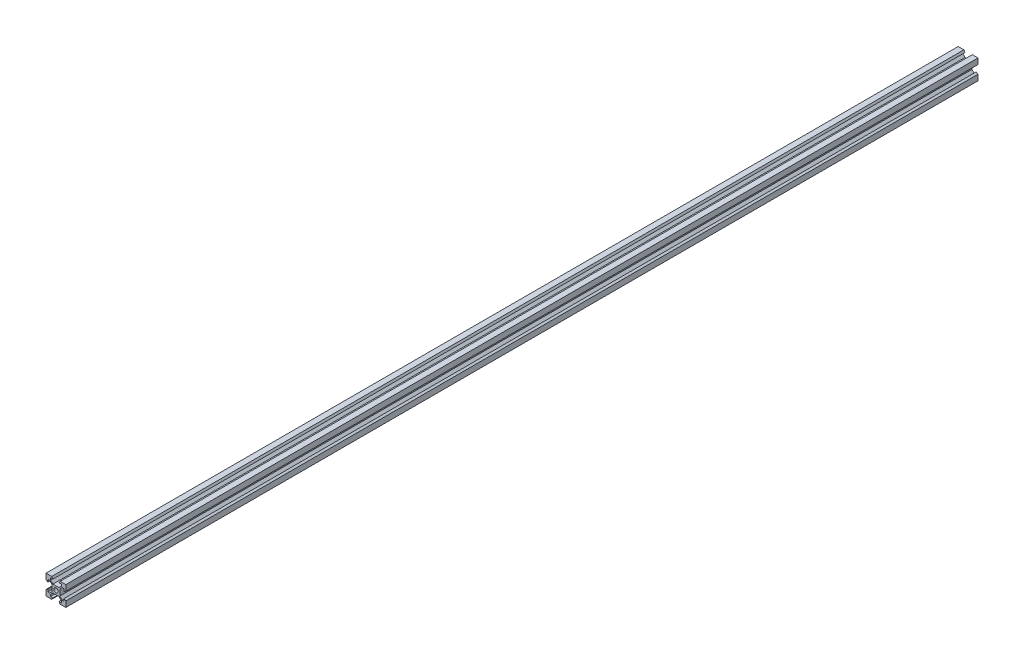
from build123d import *

# Parameters (mm, degrees)
SKETCH1_R           = 2.1
BOSS_EXTRUDE1_DEPTH = 920


with BuildPart() as part:
    # Sketch1 → Boss-Extrude1 (new body)
    with BuildSketch(Plane.XY):
        Polygon((-10, 10), (-4.25, 10), (-3.065, 8.2), (-5.5, 8.2), (-5.5, 6.348528137), (-3.051471863, 3.9), (0, 3.9), (3.051471863, 3.9), (5.5, 6.348528137), (5.5, 8.2), (3.065, 8.2), (4.25, 10), (10, 10), (10, 4.25), (8.2, 3.065), (8.2, 5.5), (6.348528137, 5.5), (3.9, 3.051471863), (3.9, 0), (3.9, -3.051471863), (6.348528137, -5.5), (8.2, -5.5), (8.2, -3.065), (10, -4.25), (10, -10), (4.25, -10), (3.065, -8.2), (5.5, -8.2), (5.5, -6.348528137), (3.051471863, -3.9), (0, -3.9), (-3.051471863, -3.9), (-5.5, -6.348528137), (-5.5, -8.2), (-3.065, -8.2), (-4.25, -10), (-10, -10), (-10, -4.25), (-8.2, -3.065), (-8.2, -5.5), (-6.348528137, -5.5), (-3.9, -3.051471863), (-3.9, 0), (-3.9, 3.051471863), (-6.348528137, 5.5), (-8.2, 5.5), (-8.2, 3.065), (-10, 4.25), align=None)
        Circle(SKETCH1_R, mode=Mode.SUBTRACT)
    extrude(amount=BOSS_EXTRUDE1_DEPTH)


solid = part.part
